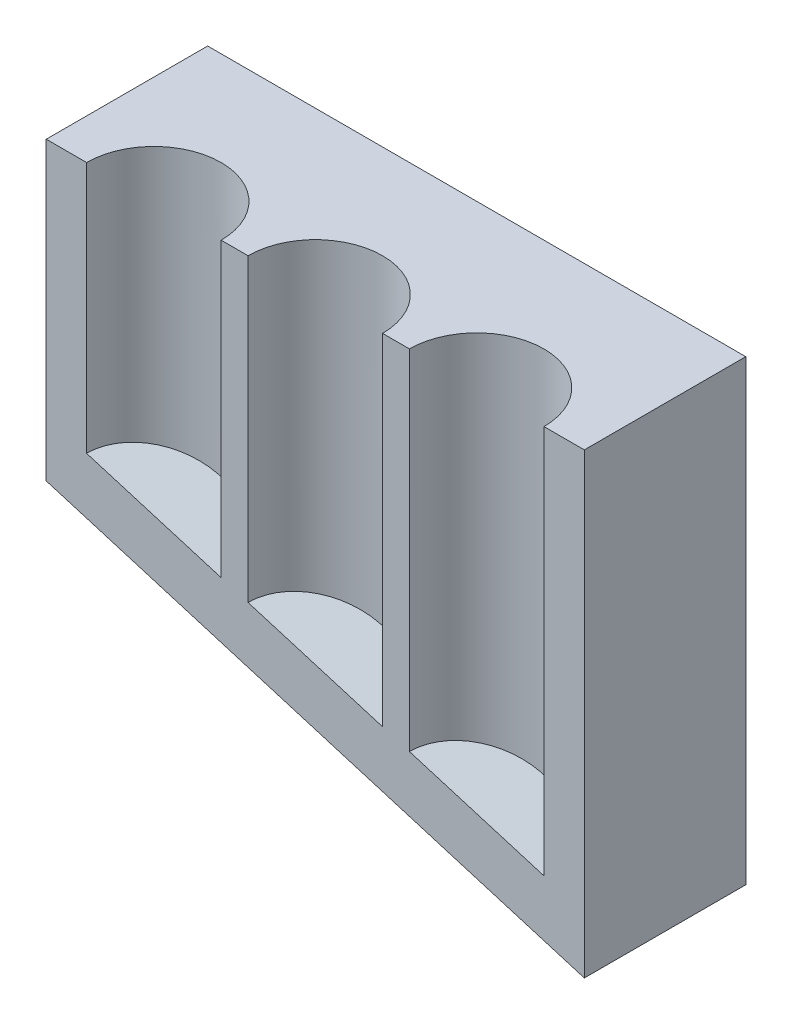
from build123d import *

# Parameters (mm, degrees)
EXTRUDE1_DEPTH    = 30
EXTRUDE2_REACH    = 136.629
SKETCH2_R         = 12.5
LPATTERN1_START   = -0.809693491
LPATTERN1_DEPTH   = 55.809693491
LPATTERN1_START_2 = -9.809693491
LPATTERN1_2_DEPTH = 55.831993491
LPATTERN1_START_3 = -17.309693491
LPATTERN1_3_DEPTH = 7.5
LPATTERN1_START_4 = -8.309693491
LPATTERN1_4_DEPTH = 7.5
LPATTERN1_START_5 = 17
LPATTERN1_5_DEPTH = 13


with BuildPart() as part:
    # Sketch1 → Extrude1 (new body)
    with BuildSketch(Plane.XY):
        Polygon((0, 0), (100, -30), (100, 55), (0, 55), align=None)
    extrude(amount=EXTRUDE1_DEPTH)

    # Extrude2: up to this plane
    extrude2_end = Plane(origin=(2.873478856, 9.578262852, 30), z_dir=(0.2873478855663455, 0.9578262852211514, 0))
    # Sketch2 → Extrude2 (cut, up to the surface)
    with BuildSketch(Plane(origin=(0, 55, 0), x_dir=(1, 0, 0), z_dir=(0, 1, 0)), mode=Mode.PRIVATE) as extrude2_sk1:
        with Locations((20, -30)):
            Circle(SKETCH2_R)
    extrude2_tool1 = split(extrude(extrude2_sk1.sketch, amount=-EXTRUDE2_REACH, mode=Mode.PRIVATE), bisect_by=extrude2_end, keep=Keep.BOTH, mode=Mode.PRIVATE)
    add(extrude2_tool1.solids().sort_by_distance((20, 55, 30))[0], mode=Mode.SUBTRACT)

    # LPattern1: read off the stored shape, not the designer's step
    # LPattern1 outline → LPattern1 (cut)
    with BuildSketch(Plane(origin=(0, 0, 0), x_dir=(1, 0, 0), z_dir=(0, 1, 0)).offset(LPATTERN1_START)):
        with BuildLine():
            Line((37.5, -30), (62.5, -30))
            ThreePointArc((62.5, -30), (50, -17.5), (37.5, -30))
        make_face()
        with BuildLine():
            ThreePointArc((92.5, -30), (80, -17.5), (67.5, -30))
            Line((67.5, -30), (92.5, -30))
        make_face()
    extrude(amount=LPATTERN1_DEPTH, mode=Mode.SUBTRACT)

    # LPattern1 2 outline → LPattern1 2 (cut)
    with BuildSketch(Plane(origin=(0, 0, 0), x_dir=(1, 0, 0), z_dir=(0, 1, 0)).offset(LPATTERN1_START_2)):
        with BuildLine():
            ThreePointArc((92.5, -30), (80, -17.5), (67.5, -30))
            Line((67.5, -30), (92.5, -30))
        make_face()
    extrude(amount=LPATTERN1_2_DEPTH, mode=Mode.SUBTRACT)

    # LPattern1 3 outline → LPattern1 3 (cut)
    with BuildSketch(Plane(origin=(0, 0, 0), x_dir=(1, 0, 0), z_dir=(0, 1, 0)).offset(LPATTERN1_START_3)):
        with BuildLine():
            ThreePointArc((92.5, -30), (80, -17.5), (67.5, -30))
            Line((67.5, -30), (92.5, -30))
        make_face()
    extrude(amount=LPATTERN1_3_DEPTH, mode=Mode.SUBTRACT)

    # LPattern1 4 outline → LPattern1 4 (cut)
    with BuildSketch(Plane(origin=(0, 0, 0), x_dir=(1, 0, 0), z_dir=(0, 1, 0)).offset(LPATTERN1_START_4)):
        with BuildLine():
            Line((37.5, -30), (62.5, -30))
            ThreePointArc((62.5, -30), (50, -17.5), (37.5, -30))
        make_face()
    extrude(amount=LPATTERN1_4_DEPTH, mode=Mode.SUBTRACT)

    # LPattern1 5 outline → LPattern1 5 (add)
    with BuildSketch(Plane.XY.offset(LPATTERN1_START_5)):
        Polygon((92.5, 55), (92.5, -17.309693491), (67.5, -9.809693491), (67.5, 55), (62.5, 55), (62.5, -8.309693491), (37.5, -0.809693491), (37.5, 55), (32.5, 55), (32.5, 0.690306509), (7.5, 8.190306509), (7.5, 55), (0, 55), (0, 0), (100, -30), (100, 55), align=None)
    extrude(amount=LPATTERN1_5_DEPTH)


solid = part.part
